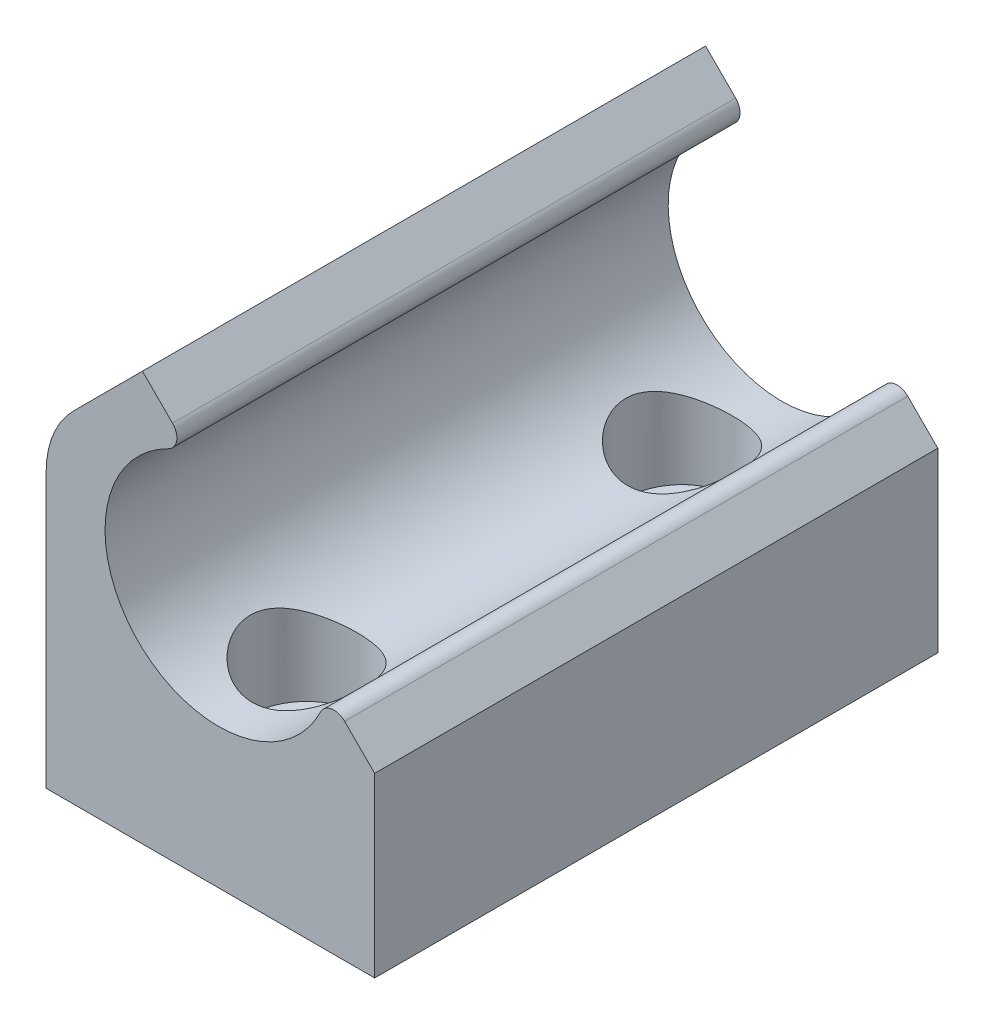
from build123d import *

# Parameters (mm, degrees)
BOSS_EXTRUDE1_DEPTH = 30
FILLET1_R           = 0.8
SKETCH3_R           = 3
CUT_EXTRUDE1_DEPTH  = 7
SKETCH4_R           = 1.55
CUT_EXTRUDE2_DEPTH  = 37.426390381
FILLET2_R           = 5


with BuildPart() as part:
    # Sketch1 → Boss-Extrude1 (new body)
    with BuildSketch(Plane.XY):
        with BuildLine():
            Line((0, 0), (17.5, 0))
            Line((17.5, 0), (17.5, 9.44))
            Line((17.5, 9.44), (15.025126266, 11.914873734))
            ThreePointArc((15.025126266, 11.914873734), (4.907782078, 9.219443047), (7.603212766, 19.336787234))
            Line((7.603212766, 19.336787234), (5.128339032, 21.811660968))
            Line((5.128339032, 21.811660968), (0, 16.683321936))
            Line((0, 16.683321936), (0, 0))
        make_face()
    extrude(amount=BOSS_EXTRUDE1_DEPTH)

    # Fillet1
    fillet1_edges = [part.edges().sort_by_distance(p)[0] for p in [
        (15.025126266, 11.914873734, 15),
        (7.603212766, 19.336787234, 15),
    ]]
    fillet(fillet1_edges, radius=FILLET1_R)

    # Sketch3 → Cut-Extrude1 (cut)
    with BuildSketch(Plane(origin=(0, 10.828405067, 0), x_dir=(-1, 0, 0), z_dir=(0, -1, 0))):
        with Locations((-8.875495285, -5)):
            Circle(SKETCH3_R)
        with Locations((-8.875495285, -25)):
            Circle(SKETCH3_R)
    extrude(amount=CUT_EXTRUDE1_DEPTH, mode=Mode.SUBTRACT)

    # Sketch4 → Cut-Extrude2 (cut, through all)
    with BuildSketch(Plane(origin=(0, 10.828405067, 0), x_dir=(-1, 0, 0), z_dir=(0, -1, 0))):
        with Locations((-8.875495285, -5)):
            Circle(SKETCH4_R)
        with Locations((-8.875495285, -25)):
            Circle(SKETCH4_R)
    extrude(amount=CUT_EXTRUDE2_DEPTH, mode=Mode.SUBTRACT)

    # Fillet2
    fillet2_edges = [part.edges().sort_by_distance(p)[0] for p in [
        (0, 16.683321936, 15),
    ]]
    fillet(fillet2_edges, radius=FILLET2_R)


solid = part.part
